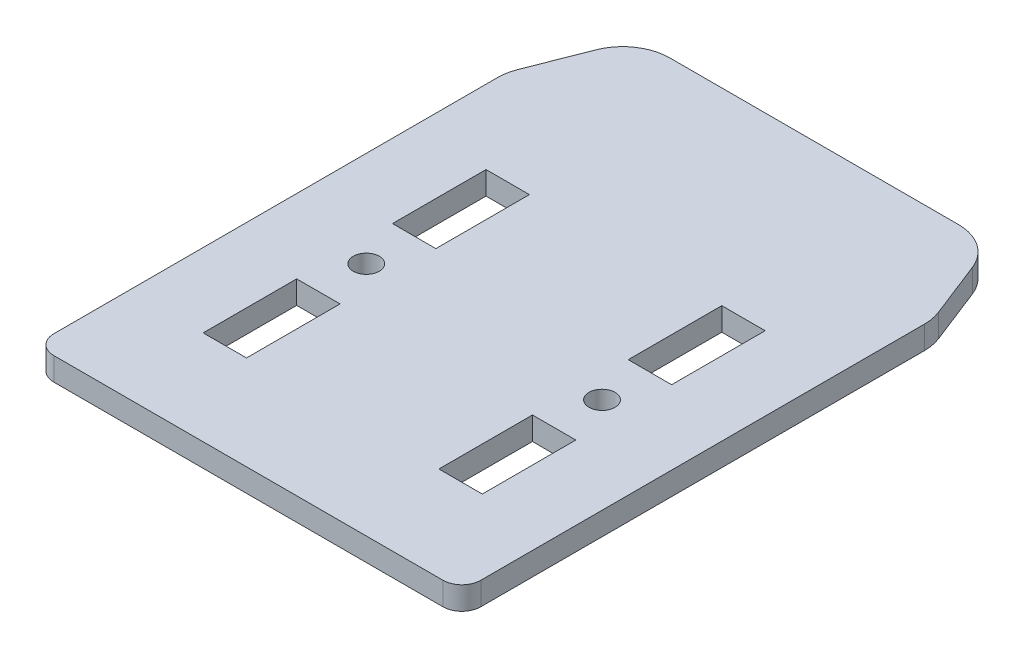
from build123d import *

# Parameters (mm, degrees)
SKETCH1_W           = 5.842
SKETCH1_H           = 12.6
BOSS_EXTRUDE1_DEPTH = 3.0988
SKETCH2_R           = 1.7526
CUT_EXTRUDE1_DEPTH  = 59.454820753
FILLET1_R           = 6.35
SKETCH3_W           = 58.835231844
SKETCH3_H           = 12.7
CUT_EXTRUDE2_DEPTH  = 59.454820753
FILLET2_R           = 2.54
SKETCH4_W           = 76.889579371
SKETCH4_H           = 12.7
CUT_EXTRUDE3_DEPTH  = 59.454820895
FILLET3_R           = 6.35


with BuildPart() as part:
    # Sketch1 → Boss-Extrude1 (new body)
    with BuildSketch(Plane(origin=(0, 0, 0), x_dir=(1, 0, 0), z_dir=(0, 1, 0))):
        Polygon((-12.954, -50.8), (12.954, -50.8), (16.0528, -50.8), (28.7528, -50.8), (28.7528, 50.8), (16.0528, 50.8), (12.954, 50.8), (-12.954, 50.8), (-16.0528, 50.8), (-28.7528, 50.8), (-28.7528, -50.8), (-16.0528, -50.8), align=None)
        with Locations((-15.875, -19.1)):
            Rectangle(SKETCH1_W, SKETCH1_H, mode=Mode.SUBTRACT)
        with Locations((15.875, -19.1)):
            Rectangle(SKETCH1_W, SKETCH1_H, mode=Mode.SUBTRACT)
        with Locations((-15.875, 6.4)):
            Rectangle(SKETCH1_W, SKETCH1_H, mode=Mode.SUBTRACT)
        with Locations((15.875, 6.4)):
            Rectangle(SKETCH1_W, SKETCH1_H, mode=Mode.SUBTRACT)
    extrude(amount=BOSS_EXTRUDE1_DEPTH)

    # Sketch2 → Cut-Extrude1 (cut, through all)
    with BuildSketch(Plane(origin=(0, 3.0988, 0), x_dir=(1, 0, 0), z_dir=(0, 1, 0))):
        Polygon((-28.7528, -50.8), (-18.796, -50.8), (-28.7528, -38.1), align=None)
        Polygon((28.7528, -38.1), (18.796, -50.8), (28.7528, -50.8), align=None)
        Polygon((-28.7528, 50.8), (-28.7528, 25.4), (-18.796, 50.8), align=None)
        Polygon((18.796, 50.8), (28.7528, 25.4), (28.7528, 50.8), align=None)
        with Locations((-15.875, -6.35)):
            Circle(SKETCH2_R)
        with Locations((15.875, -6.35)):
            Circle(SKETCH2_R)
    extrude(amount=-CUT_EXTRUDE1_DEPTH, mode=Mode.SUBTRACT)

    # Fillet1
    fillet1_edges = [part.edges().sort_by_distance(p)[0] for p in [
        (18.796, 1.5494, 50.8),
        (-18.796, 1.5494, 50.8),
        (-28.7528, 1.5494, 38.1),
        (-28.7528, 1.5494, -25.4),
        (-18.796, 1.5494, -50.8),
        (18.796, 1.5494, -50.8),
        (28.7528, 1.5494, -25.4),
        (28.7528, 1.5494, 38.1),
    ]]
    fillet(fillet1_edges, radius=FILLET1_R)

    # Sketch3 → Cut-Extrude2 (cut, through all)
    with BuildSketch(Plane(origin=(0, 0, 0), x_dir=(-1, 0, 0), z_dir=(0, -1, 0))):
        with Locations((0.664815922, -44.45)):
            Rectangle(SKETCH3_W, SKETCH3_H)
    extrude(amount=-CUT_EXTRUDE2_DEPTH, mode=Mode.SUBTRACT)

    # Fillet2
    fillet2_edges = [part.edges().sort_by_distance(p)[0] for p in [
        (-28.362298152, 1.5494, 38.1),
        (28.362298152, 1.5494, 38.1),
    ]]
    fillet(fillet2_edges, radius=FILLET2_R)

    # Sketch4 → Cut-Extrude3 (cut, through all)
    with BuildSketch(Plane(origin=(0, 0, 0), x_dir=(-1, 0, 0), z_dir=(0, -1, 0))):
        with Locations((3.167610928, 44.45)):
            Rectangle(SKETCH4_W, SKETCH4_H)
    extrude(amount=-CUT_EXTRUDE3_DEPTH, mode=Mode.SUBTRACT)

    # Fillet3
    fillet3_edges = [part.edges().sort_by_distance(p)[0] for p in [
        (23.7744, 1.5494, -38.1),
        (-23.7744, 1.5494, -38.1),
    ]]
    fillet(fillet3_edges, radius=FILLET3_R)


solid = part.part
